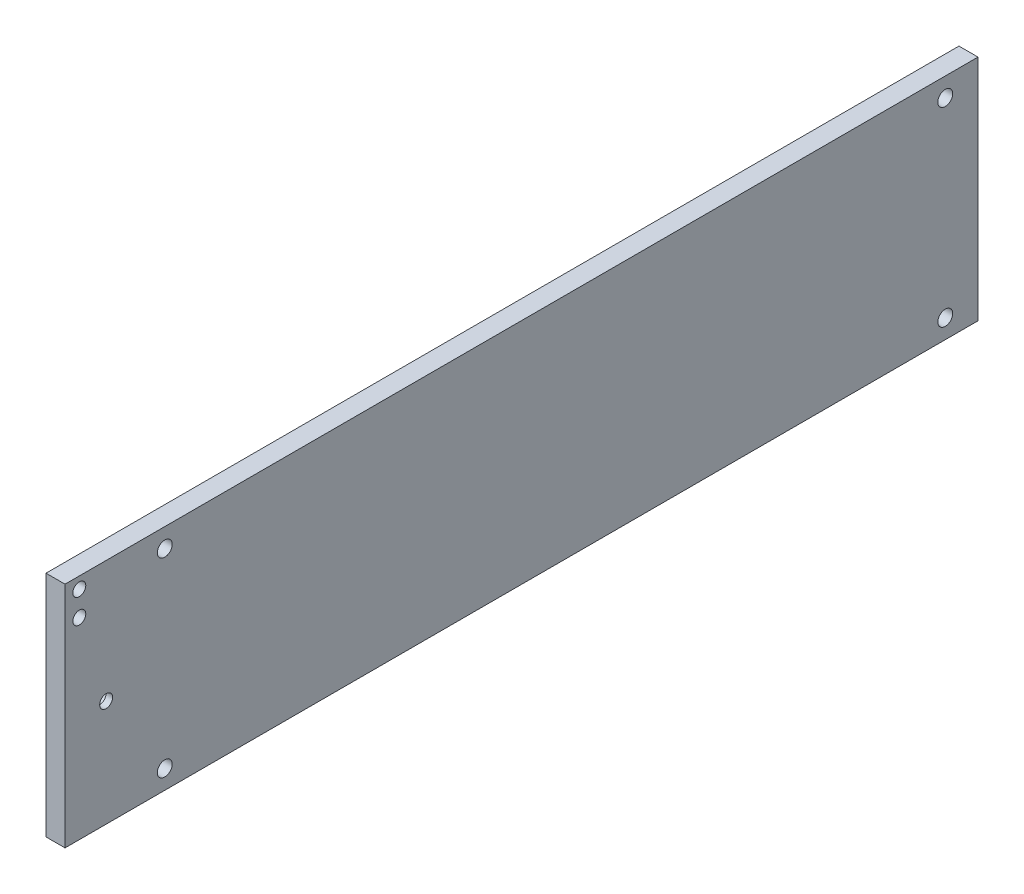
from build123d import *

# Parameters (mm, degrees)
SKETCH1_W                                      = 304.546
SKETCH1_H                                      = 76.2
BOSS_EXTRUDE1_DEPTH                            = 6.35
F_10_CLEARANCE_HOLE1_D                         = 4.9784
CBORE_FOR_8_SOCKET_HEAD_CAP_SCREW2_D           = 4.3053
CBORE_FOR_8_SOCKET_HEAD_CAP_SCREW2_DEPTH       = 10.668
CBORE_FOR_8_SOCKET_HEAD_CAP_SCREW2_CBORE_D     = 7.9375
CBORE_FOR_8_SOCKET_HEAD_CAP_SCREW2_CBORE_DEPTH = 4.1656
CBORE_FOR_8_SOCKET_HEAD_CAP_SCREW2_TIP         = 1.293442612
F_8_CLEARANCE_HOLE1_D                          = 4.3053


with BuildPart() as part:
    # Sketch1 → Boss-Extrude1 (new body)
    with BuildSketch(Plane(origin=(0, 0, 0), x_dir=(0, 0, -1), z_dir=(1, 0, 0))):
        Rectangle(SKETCH1_W, SKETCH1_H)
    extrude(amount=BOSS_EXTRUDE1_DEPTH)

    # #10 Clearance Hole1 (through all)
    with Locations(Plane(origin=(6.35, 0, 0), x_dir=(0, 0, -1), z_dir=(1, 0, 0))):
        with Locations((-118.999, 31.75), (-118.999, -31.75), (141.351, -31.75), (141.351, 31.75)):
            Hole(F_10_CLEARANCE_HOLE1_D / 2)

    # CBORE for #8 Socket Head Cap Screw2
    with Locations(Plane.ZY):
        with Locations((138.557, -2.54)):
            CounterBoreHole(CBORE_FOR_8_SOCKET_HEAD_CAP_SCREW2_D / 2, CBORE_FOR_8_SOCKET_HEAD_CAP_SCREW2_CBORE_D / 2, CBORE_FOR_8_SOCKET_HEAD_CAP_SCREW2_CBORE_DEPTH, depth=CBORE_FOR_8_SOCKET_HEAD_CAP_SCREW2_DEPTH)
            with Locations((0, 0, -(CBORE_FOR_8_SOCKET_HEAD_CAP_SCREW2_DEPTH + CBORE_FOR_8_SOCKET_HEAD_CAP_SCREW2_TIP / 2))):  # 118° drill point
                Cone(0, CBORE_FOR_8_SOCKET_HEAD_CAP_SCREW2_D / 2, CBORE_FOR_8_SOCKET_HEAD_CAP_SCREW2_TIP, mode=Mode.SUBTRACT)

    # #8 Clearance Hole1 (through all)
    with Locations(Plane.ZY):
        with Locations((147.5105, 34.2519), (147.5105, 26.0731)):
            Hole(F_8_CLEARANCE_HOLE1_D / 2)


solid = part.part
